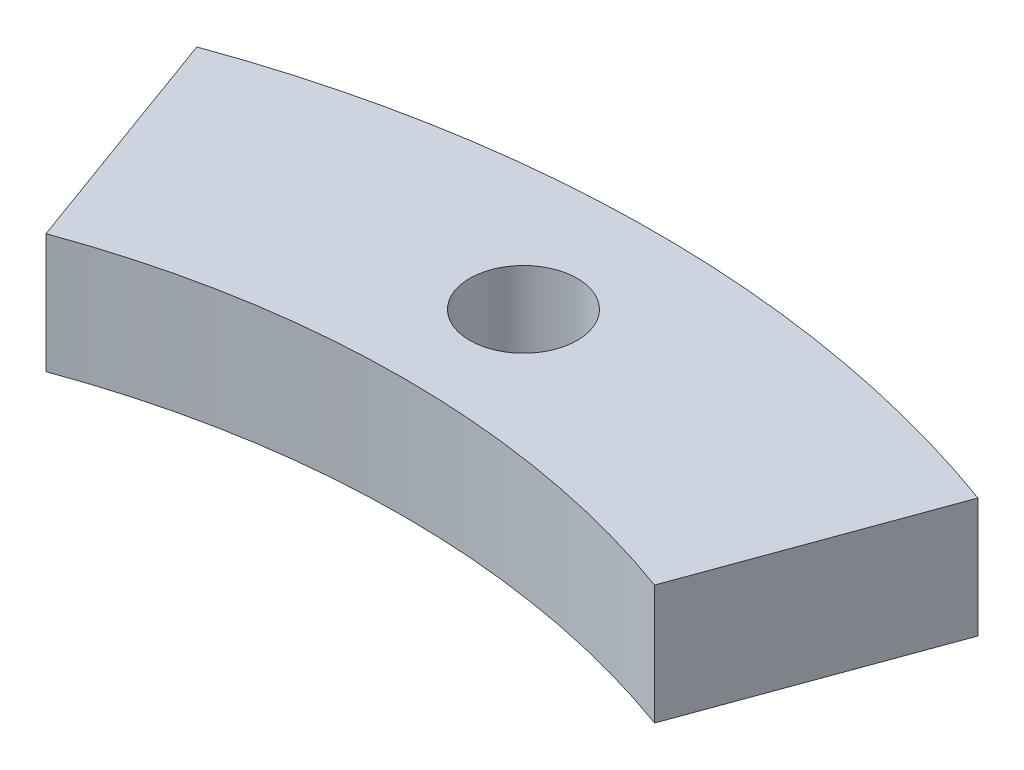
from build123d import *

# Parameters (mm, degrees)
SKETCH1_R               = 43
SKETCH1_R_2             = 33.5
BOSS_EXTRUDE1_DEPTH     = 4.5
CUT_EXTRUDE1_DEPTH      = 61.97745485
CUT_EXTRUDE2_DEPTH      = 46.667733821
CUT_EXTRUDE2_DEPTH_BACK = 46.667733821
SKETCH3_R               = 2.025


with BuildPart() as part:
    # Sketch1 → Boss-Extrude1 (new body)
    with BuildSketch(Plane(origin=(0, 0, 0), x_dir=(1, 0, 0), z_dir=(0, 1, 0))):
        Circle(SKETCH1_R)
        Circle(SKETCH1_R_2, mode=Mode.SUBTRACT)
    extrude(amount=BOSS_EXTRUDE1_DEPTH)

    # Sketch2 → Cut-Extrude1 (cut, symmetric)
    with BuildSketch(Plane(origin=(0, 4.5, 0), x_dir=(1, 0, 0), z_dir=(0, 1, 0))):
        with BuildLine():
            Line((0, 0), (0, -52.31984462))
            ThreePointArc((0, -52.31984462), (51.524988618, -9.085245674), (17.894440756, 49.16457191))
            Line((17.894440756, 49.16457191), (0, 0))
        make_face()
    cut_extrude1 = extrude(amount=CUT_EXTRUDE1_DEPTH, both=True, mode=Mode.SUBTRACT)

    # Mirror1: Cut-Extrude1 across plane
    add(cut_extrude1.mirror(Plane(origin=(0, 0, 0), x_dir=(0, 0, 1), z_dir=(1, 0, 0))), mode=Mode.SUBTRACT)

    # Sketch3 → Cut-Extrude2 (cut, two sides: drawn at the far end of the back side and taken through both)
    with BuildSketch(Plane(origin=(0, 4.5, 0), x_dir=(1, 0, 0), z_dir=(0, 1, 0)).offset(-CUT_EXTRUDE2_DEPTH_BACK)):
        with Locations((0, 38)):
            Circle(SKETCH3_R)
    extrude(amount=CUT_EXTRUDE2_DEPTH + CUT_EXTRUDE2_DEPTH_BACK, mode=Mode.SUBTRACT)


solid = part.part
